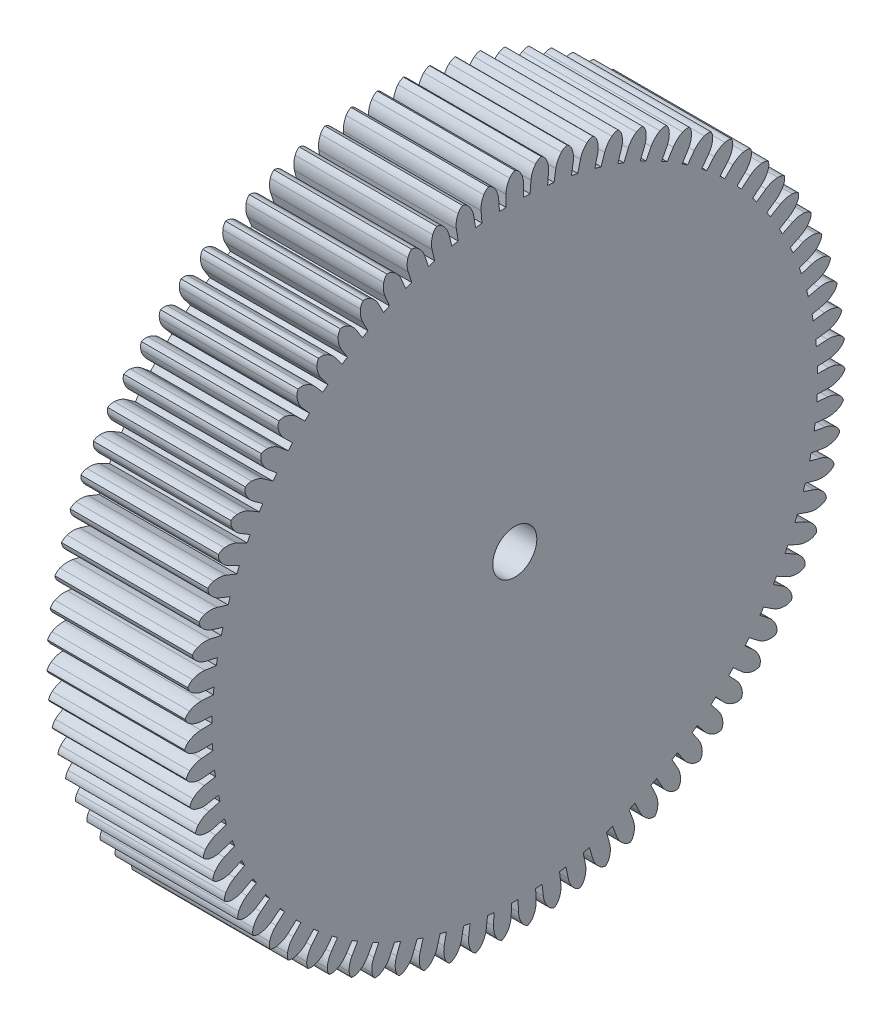
from build123d import *

# Parameters (mm, degrees)
SKETCH1_R           = 1.6
BOSS_EXTRUDE1_DEPTH = 10


with BuildPart() as part:
    # Sketch1 → Boss-Extrude1 (new body)
    with BuildSketch(Plane(origin=(0, 0, 0), x_dir=(0, 0, -1), z_dir=(1, 0, 0))):
        with BuildLine():
            Line((-0.64, 22.814432438), (-0.64, 21.990688939))
            ThreePointArc((-0.64, 21.990688939), (-0.874643332, 21.982606739), (-1.109187051, 21.972020938))
            Line((-1.109187051, 21.972020938), (-1.17463361, 22.793160452))
            ThreePointArc((-1.17463361, 22.793160452), (-1.278682757, 23.246762215), (-1.508864238, 23.651233809))
            ThreePointArc((-1.508864238, 23.651233809), (-1.686768732, 23.818400481), (-1.906804007, 23.924132136))
            ThreePointArc((-1.906804007, 23.924132136), (-2.107313727, 23.784882154), (-2.256493367, 23.591646184))
            ThreePointArc((-2.256493367, 23.591646184), (-2.419701384, 23.155820613), (-2.450587324, 22.691464238))
            Line((-2.450587324, 22.691464238), (-2.385140765, 21.870324724))
            ThreePointArc((-2.385140765, 21.870324724), (-2.61840022, 21.843625621), (-2.851361464, 21.814438746))
            Line((-2.851361464, 21.814438746), (-2.981840807, 22.627782766))
            ThreePointArc((-2.981840807, 22.627782766), (-3.121599774, 23.071683899), (-3.38318895, 23.456588936))
            ThreePointArc((-3.38318895, 23.456588936), (-3.57381248, 23.609092625), (-3.801552586, 23.697008206))
            ThreePointArc((-3.801552586, 23.697008206), (-3.990365027, 23.542267885), (-4.123720457, 23.337790418))
            ThreePointArc((-4.123720457, 23.337790418), (-4.251786133, 22.890375658), (-4.245681245, 22.425033294))
            Line((-4.245681245, 22.425033294), (-4.115201902, 21.611689275))
            ThreePointArc((-4.115201902, 21.611689275), (-4.345602738, 21.56654207), (-4.575508653, 21.518938649))
            Line((-4.575508653, 21.518938649), (-4.770195847, 22.319344952))
            ThreePointArc((-4.770195847, 22.319344952), (-4.944781033, 22.750738968), (-5.236124053, 23.113643955))
            ThreePointArc((-5.236124053, 23.113643955), (-5.438261435, 23.250520484), (-5.672266525, 23.320064161))
            ThreePointArc((-5.672266525, 23.320064161), (-5.848187956, 23.150811819), (-5.964876058, 22.936385626))
            ThreePointArc((-5.964876058, 22.936385626), (-6.056989721, 22.480210377), (-6.013932603, 22.01682407))
            Line((-6.013932603, 22.01682407), (-5.819245408, 21.216417767))
            ThreePointArc((-5.819245408, 21.216417767), (-6.045330957, 21.153107895), (-6.270728002, 21.087388893))
            Line((-6.270728002, 21.087388893), (-6.528392174, 21.869797052))
            ThreePointArc((-6.528392174, 21.869797052), (-6.736699794, 22.285956541), (-7.055954694, 22.624567075))
            ThreePointArc((-7.055954694, 22.624567075), (-7.268327949, 22.744951067), (-7.507118569, 22.795683161))
            ThreePointArc((-7.507118569, 22.795683161), (-7.669036756, 22.612988866), (-7.768319792, 22.38996962))
            ThreePointArc((-7.768319792, 22.38996962), (-7.823899069, 21.927917968), (-7.744161942, 21.469417395))
            Line((-7.744161942, 21.469417395), (-7.48649777, 20.687009236))
            ThreePointArc((-7.48649777, 20.687009236), (-7.706838646, 20.605936962), (-7.92630179, 20.522517875))
            Line((-7.92630179, 20.522517875), (-8.245313902, 21.281981255))
            ThreePointArc((-8.245313902, 21.281981255), (-8.48602697, 21.680275121), (-8.831175317, 21.992450398))
            ThreePointArc((-8.831175317, 21.992450398), (-9.052441755, 22.095580746), (-9.294508192, 22.127180513))
            ThreePointArc((-9.294508192, 22.127180513), (-9.441399438, 21.932199317), (-9.522649708, 21.701997017))
            ThreePointArc((-9.522649708, 21.701997017), (-9.541343208, 21.236990202), (-9.425430196, 20.786274151))
            Line((-9.425430196, 20.786274151), (-9.106418084, 20.026810772))
            ThreePointArc((-9.106418084, 20.026810772), (-9.319621221, 19.928488661), (-9.531762946, 19.827896892))
            Line((-9.531762946, 19.827896892), (-9.910106102, 20.55961392))
            ThreePointArc((-9.910106102, 20.55961392), (-10.181702751, 20.937524022), (-10.550562406, 21.221290368))
            ThreePointArc((-10.550562406, 21.221290368), (-10.779323109, 21.306515049), (-11.023134941, 21.318782706))
            ThreePointArc((-11.023134941, 21.318782706), (-11.154070552, 21.112747342), (-11.216774366, 20.876817402))
            ThreePointArc((-11.216774366, 20.876817402), (-11.198463904, 20.411795346), (-11.047107846, 19.97171339))
            Line((-11.047107846, 19.97171339), (-10.66876469, 19.239996362))
            ThreePointArc((-10.66876469, 19.239996362), (-10.87348215, 19.125046038), (-11.076961227, 19.00791756))
            Line((-11.076961227, 19.00791756), (-11.51224342, 19.707262086))
            ThreePointArc((-11.51224342, 19.707262086), (-11.813006529, 20.062399154), (-12.203245443, 20.315962508))
            ThreePointArc((-12.203245443, 20.315962508), (-12.438054111, 20.382742704), (-12.682069883, 20.37560069))
            ThreePointArc((-12.682069883, 20.37560069), (-12.796222041, 20.159813781), (-12.839982965, 19.919647825))
            ThreePointArc((-12.839982965, 19.919647825), (-12.784784305, 19.457550548), (-12.598942123, 19.030885026))
            Line((-12.598942123, 19.030885026), (-12.163659931, 18.3315405))
            ThreePointArc((-12.163659931, 18.3315405), (-12.358597423, 18.200688716), (-12.552127393, 18.067764054))
            Line((-12.552127393, 18.067764054), (-13.041596629, 18.730314596))
            ThreePointArc((-13.041596629, 18.730314596), (-13.369624676, 19.06043334), (-13.778775633, 19.282190592))
            ThreePointArc((-13.778775633, 19.282190592), (-14.018147731, 19.330104097), (-14.260824695, 19.303597566))
            ThreePointArc((-14.260824695, 19.303597566), (-14.357471694, 19.079423387), (-14.382013057, 18.836539821))
            ThreePointArc((-14.382013057, 18.836539821), (-14.290275184, 18.380288851), (-14.071121832, 17.969737279))
            Line((-14.071121832, 17.969737279), (-13.581652597, 17.307186737))
            ThreePointArc((-13.581652597, 17.307186737), (-13.765577665, 17.16126078), (-13.947934969, 17.013380326))
            Line((-13.947934969, 17.013380326), (-14.488496664, 17.634948027))
            ThreePointArc((-14.488496664, 17.634948027), (-14.841715751, 17.937961329), (-15.267191967, 18.126510459))
            ThreePointArc((-15.267191967, 18.126510459), (-15.509614107, 18.155254349), (-15.749417982, 18.109550884))
            ThreePointArc((-15.749417982, 18.109550884), (-15.827948789, 17.878406735), (-15.833115432, 17.634341147))
            ThreePointArc((-15.833115432, 17.634341147), (-15.705418342, 17.186821049), (-15.454339378, 16.794979068))
            Line((-15.454339378, 16.794979068), (-14.913777683, 16.173411367))
            ThreePointArc((-14.913777683, 16.173411367), (-15.085527492, 16.013333828), (-15.255559209, 15.851432529))
            Line((-15.255559209, 15.851432529), (-15.843795759, 16.428087638))
            ThreePointArc((-15.843795759, 16.428087638), (-16.219972721, 16.70207975), (-16.659084198, 16.85622869))
            ThreePointArc((-16.659084198, 16.85622869), (-16.90302371, 16.865621236), (-17.138438378, 16.80100979))
            ThreePointArc((-17.138438378, 16.80100979), (-17.198356495, 16.564357039), (-17.184115754, 16.320652491))
            ThreePointArc((-17.184115754, 16.320652491), (-17.021266788, 15.884692632), (-16.739849614, 15.514037591))
            Line((-16.739849614, 15.514037591), (-16.151613064, 14.937382482))
            ThreePointArc((-16.151613064, 14.937382482), (-16.310101757, 14.764165424), (-16.466732891, 14.589266873))
            Line((-16.466732891, 14.589266873), (-17.098925276, 15.11736359))
            ThreePointArc((-17.098925276, 15.11736359), (-17.495681801, 15.360602247), (-17.945652335, 15.479376417))
            ThreePointArc((-17.945652335, 15.479376417), (-18.189566954, 15.469358236), (-18.419104049, 15.386247302))
            ThreePointArc((-18.419104049, 15.386247302), (-18.460030654, 15.145582144), (-18.426472563, 14.903779415))
            ThreePointArc((-18.426472563, 14.903779415), (-18.229501305, 14.482136073), (-17.919525132, 14.135011374))
            Line((-17.919525132, 14.135011374), (-17.287332747, 13.606914657))
            ThreePointArc((-17.287332747, 13.606914657), (-17.431558308, 13.421653212), (-17.573798587, 13.234863174))
            Line((-17.573798587, 13.234863174), (-18.245949882, 13.711062701))
            ThreePointArc((-18.245949882, 13.711062701), (-18.660777548, 13.92201007), (-19.11876228, 14.004658542))
            ThreePointArc((-19.11876228, 14.004658542), (-19.361109899, 13.975292973), (-19.583318213, 13.874208005))
            ThreePointArc((-19.583318213, 13.874208005), (-19.604994555, 13.631052003), (-19.55233128, 13.392679847))
            ThreePointArc((-19.55233128, 13.392679847), (-19.322483046, 12.988018787), (-18.985907642, 12.666619063))
            Line((-18.985907642, 12.666619063), (-18.313756347, 12.190419536))
            ThreePointArc((-18.313756347, 12.190419536), (-18.442806935, 11.994284988), (-18.569757069, 11.796784409))
            Line((-18.569757069, 11.796784409), (-19.277617718, 12.21807606))
            ThreePointArc((-19.277617718, 12.21807606), (-19.707893851, 12.395398463), (-20.170997254, 12.441398706))
            ThreePointArc((-20.170997254, 12.441398706), (-20.410245674, 12.392871408), (-20.623720334, 12.274451498))
            ThreePointArc((-20.623720334, 12.274451498), (-20.626009369, 12.030341963), (-20.554573864, 11.796907445))
            ThreePointArc((-20.554573864, 11.796907445), (-20.293301828, 11.411787064), (-19.932255131, 11.118144309))
            Line((-19.932255131, 11.118144309), (-19.224394483, 10.696852658))
            ThreePointArc((-19.224394483, 10.696852658), (-19.337454198, 10.491085031), (-19.448311569, 10.284122574))
            Line((-19.448311569, 10.284122574), (-20.187406248, 10.647842808))
            ThreePointArc((-20.187406248, 10.647842808), (-20.630410503, 10.790419156), (-21.095704689, 10.799480342))
            ThreePointArc((-21.095704689, 10.799480342), (-21.330341305, 10.73209812), (-21.533732655, 10.597091957))
            ThreePointArc((-21.533732655, 10.597091957), (-21.51661991, 10.353572227), (-21.426863813, 10.126551196))
            ThreePointArc((-21.426863813, 10.126551196), (-21.135819822, 9.763406349), (-20.752584486, 9.499377067))
            Line((-20.752584486, 9.499377067), (-20.013489806, 9.135656833))
            ThreePointArc((-20.013489806, 9.135656833), (-20.10984385, 8.921557058), (-20.203907581, 8.706441206))
            Line((-20.203907581, 8.706441206), (-20.969563496, 9.010290466))
            ThreePointArc((-20.969563496, 9.010290466), (-21.422495058, 9.117219344), (-21.887038287, 9.089284186))
            ThreePointArc((-21.887038287, 9.089284186), (-22.11557965, 9.003473052), (-22.307601785, 8.852734189))
            ThreePointArc((-22.307601785, 8.852734189), (-22.271195453, 8.611343873), (-22.16368623, 8.39217163))
            ThreePointArc((-22.16368623, 8.39217163), (-21.844710357, 8.053298236), (-21.441709319, 7.820551704))
            Line((-21.441709319, 7.820551704), (-20.676053404, 7.516702444))
            ThreePointArc((-20.676053404, 7.516702444), (-20.755092594, 7.295624128), (-20.831767984, 7.073714913))
            Line((-20.831767984, 7.073714913), (-21.619144412, 7.315772166))
            ThreePointArc((-21.619144412, 7.315772166), (-22.079139701, 7.386377537), (-22.539994982, 7.321622649))
            ThreePointArc((-22.539994982, 7.321622649), (-22.760996179, 7.217925128), (-22.940435074, 7.052406584))
            ThreePointArc((-22.940435074, 7.052406584), (-22.884965328, 6.814671832), (-22.760382687, 6.604734053))
            ThreePointArc((-22.760382687, 6.604734053), (-22.415491601, 6.292274579), (-21.995272763, 6.092282296))
            Line((-21.995272763, 6.092282296), (-21.207896335, 5.850225042))
            ThreePointArc((-21.207896335, 5.850225042), (-21.26912096, 5.623565914), (-21.327923243, 5.396266317))
            Line((-21.327923243, 5.396266317), (-22.132042136, 5.575001199))
            ThreePointArc((-22.132042136, 5.575001199), (-22.596192915, 5.608836673), (-23.050446571, 5.507671456))
            ThreePointArc((-23.050446571, 5.507671456), (-23.262510363, 5.386743158), (-23.428231546, 5.207491395))
            ThreePointArc((-23.428231546, 5.207491395), (-23.354049083, 4.974915241), (-23.213180677, 4.775539221))
            ThreePointArc((-23.213180677, 4.775539221), (-22.844554889, 4.491469135), (-22.409775011, 4.325495517))
            Line((-22.409775011, 4.325495517), (-21.605656117, 4.146760634))
            ThreePointArc((-21.605656117, 4.146760634), (-21.648679096, 3.915953705), (-21.689236504, 3.684700787))
            Line((-21.689236504, 3.684700787), (-22.505013964, 3.79898328))
            ThreePointArc((-22.505013964, 3.79898328), (-22.970385722, 3.795834937), (-23.415165815, 3.658898991))
            ThreePointArc((-23.415165815, 3.658898991), (-23.616951466, 3.521504463), (-23.767907195, 3.329652768))
            ThreePointArc((-23.767907195, 3.329652768), (-23.675481021, 3.103705634), (-23.519217464, 2.916151892))
            ThreePointArc((-23.519217464, 2.916151892), (-23.129187546, 2.662267178), (-22.682595445, 2.531361563))
            Line((-22.682595445, 2.531361563), (-21.866817985, 2.41707907))
            ThreePointArc((-21.866817985, 2.41707907), (-21.891367311, 2.183583576), (-21.913423428, 1.949839393))
            Line((-21.913423428, 1.949839393), (-22.735701848, 1.998946965))
            ThreePointArc((-22.735701848, 1.998946965), (-23.199352354, 1.958834711), (-23.631846842, 1.786993789))
            ThreePointArc((-23.631846842, 1.786993789), (-23.822078598, 1.634001683), (-23.957314483, 1.430763004))
            ThreePointArc((-23.957314483, 1.430763004), (-23.847228945, 1.2128734), (-23.676558186, 1.038327711))
            ThreePointArc((-23.676558186, 1.038327711), (-23.267590033, 0.81623351), (-22.812009208, 0.721223526))
            Line((-22.812009208, 0.721223526), (-21.989730788, 0.672115954))
            ThreePointArc((-21.989730788, 0.672115954), (-21.995651255, 0.437408129), (-21.999066634, 0.202650487))
            Line((-21.999066634, 0.202650487), (-22.822647304, 0.186272664))
            ThreePointArc((-22.822647304, 0.186272664), (-23.281645211, 0.109450101), (-23.699119725, -0.096209364))
            ThreePointArc((-23.699119725, -0.096209364), (-23.876594879, -0.263831781), (-23.995255914, -0.477172504))
            ThreePointArc((-23.995255914, -0.477172504), (-23.868207009, -0.685627009), (-23.684208084, -0.846061111))
            ThreePointArc((-23.684208084, -0.846061111), (-23.258887324, -1.034960648), (-22.797198104, -1.093474318))
            Line((-22.797198104, -1.093474318), (-21.973617434, -1.077096495))
            ThreePointArc((-21.973617434, -1.077096495), (-21.960871609, -1.311532754), (-21.945624658, -1.545819641))
            Line((-21.945624658, -1.545819641), (-22.765300636, -1.627579313))
            ThreePointArc((-22.765300636, -1.627579313), (-23.216744012, -1.740626488), (-23.616559142, -1.97880425))
            ThreePointArc((-23.616559142, -1.97880425), (-23.78015564, -2.159997217), (-23.881491613, -2.382091174))
            ThreePointArc((-23.881491613, -2.382091174), (-23.738282584, -2.579792664), (-23.542118793, -2.725100862))
            ThreePointArc((-23.542118793, -2.725100862), (-23.10313444, -2.879611453), (-22.638255774, -2.901258866))
            Line((-22.638255774, -2.901258866), (-21.818579796, -2.819499194))
            ThreePointArc((-21.818579796, -2.819499194), (-21.787248262, -3.052181704), (-21.753435377, -3.2845166))
            Line((-21.753435377, -3.2845166), (-22.564024408, -3.43114121))
            ThreePointArc((-22.564024408, -3.43114121), (-23.005059081, -3.579698276), (-23.384687069, -3.848888498))
            ThreePointArc((-23.384687069, -3.848888498), (-23.5333706, -4.042506454), (-23.616740831, -4.271949496))
            ThreePointArc((-23.616740831, -4.271949496), (-23.458277093, -4.457648039), (-23.251188647, -4.586911649))
            ThreePointArc((-23.251188647, -4.586911649), (-22.801316102, -4.706056426), (-22.336187102, -4.690700721))
            Line((-22.336187102, -4.690700721), (-21.525598071, -4.544076111))
            ThreePointArc((-21.525598071, -4.544076111), (-21.475878917, -4.773533778), (-21.423713874, -5.002447787))
            Line((-21.423713874, -5.002447787), (-22.220091152, -5.213010327))
            ThreePointArc((-22.220091152, -5.213010327), (-22.64792876, -5.396138059), (-23.004969475, -5.694638834))
            ThreePointArc((-23.004969475, -5.694638834), (-23.137800014, -5.899457664), (-23.202677411, -6.134799179))
            ThreePointArc((-23.202677411, -6.134799179), (-23.029960822, -6.307320728), (-22.813257, -6.419722503))
            ThreePointArc((-22.813257, -6.419722503), (-22.355340502, -6.502748195), (-21.892901863, -6.450486455))
            Line((-21.892901863, -6.450486455), (-21.096524584, -6.239923916))
            ThreePointArc((-21.096524584, -6.239923916), (-21.028732151, -6.464706035), (-20.958544753, -6.688751889))
            Line((-20.958544753, -6.688751889), (-21.735675326, -6.961921114))
            ThreePointArc((-21.735675326, -6.961921114), (-22.147610942, -7.178461719), (-22.479807057, -7.50438583))
            ThreePointArc((-22.479807057, -7.50438583), (-22.595944807, -7.719110603), (-22.641919193, -7.958862685))
            ThreePointArc((-22.641919193, -7.958862685), (-22.456041723, -8.117116505), (-22.231092598, -8.211945805))
            ThreePointArc((-22.231092598, -8.211945805), (-21.768027242, -8.258327497), (-21.31120265, -8.169490138))
            Line((-21.31120265, -8.169490138), (-20.534072077, -7.896320913))
            ThreePointArc((-20.534072077, -7.896320913), (-20.448634969, -8.11500634), (-20.360868965, -8.332767548))
            Line((-20.360868965, -8.332767548), (-21.113839563, -8.666816394))
            ThreePointArc((-21.113839563, -8.666816394), (-21.507268796, -8.915400833), (-21.81252006, -9.266687682))
            ThreePointArc((-21.81252006, -9.266687682), (-21.911230762, -9.489960839), (-21.938011472, -9.7326077))
            ThreePointArc((-21.938011472, -9.7326077), (-21.740148299, -9.875593257), (-21.50837607, -9.952250541))
            ThreePointArc((-21.50837607, -9.952250541), (-21.043089505, -9.961694994), (-20.594767152, -9.836843673))
            Line((-20.594767152, -9.836843673), (-19.841796554, -9.502794826))
            ThreePointArc((-19.841796554, -9.502794826), (-19.739254934, -9.714000961), (-19.634465207, -9.924100767))
            Line((-19.634465207, -9.924100767), (-20.358515307, -10.316917271))
            ThreePointArc((-20.358515307, -10.316917271), (-20.730950772, -10.595973913), (-21.007327289, -10.970402552))
            ThreePointArc((-21.007327289, -10.970402552), (-21.087986861, -11.200812488), (-21.09540458, -11.444820034))
            ThreePointArc((-21.09540458, -11.444820034), (-20.886806657, -11.571633329), (-20.649676663, -11.629633945))
            ThreePointArc((-20.649676663, -11.629633945), (-20.185110581, -11.602081447), (-19.748124905, -11.442005516))
            Line((-19.748124905, -11.442005516), (-19.024074805, -11.049189011))
            ThreePointArc((-19.024074805, -11.049189011), (-18.905076973, -11.25158054), (-18.783926039, -11.452690626))
            Line((-18.783926039, -11.452690626), (-19.474477963, -11.901791275))
            ThreePointArc((-19.474477963, -11.901791275), (-19.823565003, -12.209555834), (-20.069319431, -12.604759004))
            ThreePointArc((-20.069319431, -12.604759004), (-20.131417917, -12.840848994), (-20.119425747, -13.084674532))
            ThreePointArc((-20.119425747, -13.084674532), (-19.901411898, -13.19451381), (-19.660423352, -13.233491058))
            ThreePointArc((-19.660423352, -13.233491058), (-19.199514889, -13.169115806), (-18.776628654, -12.974827315))
            Line((-18.776628654, -12.974827315), (-18.08607673, -12.525726666))
            ThreePointArc((-18.08607673, -12.525726666), (-17.951375028, -12.718024005), (-17.814628842, -12.908872887))
            Line((-17.814628842, -12.908872887), (-18.467316699, -13.411418323))
            ThreePointArc((-18.467316699, -13.411418323), (-18.790848273, -13.745945012), (-19.004426874, -14.159424111))
            ThreePointArc((-19.004426874, -14.159424111), (-19.047571667, -14.399701518), (-19.016245427, -14.641803504))
            ThreePointArc((-19.016245427, -14.641803504), (-18.790194006, -14.733974326), (-18.546870515, -14.753681781))
            ThreePointArc((-18.546870515, -14.753681781), (-18.092533682, -14.652890774), (-17.686420512, -14.425618079))
            Line((-17.686420512, -14.425618079), (-17.033732655, -13.923072643))
            ThreePointArc((-17.033732655, -13.923072643), (-16.884178711, -14.104060027), (-16.732701826, -14.283441098))
            Line((-16.732701826, -14.283441098), (-17.343399113, -14.836254066))
            ThreePointArc((-17.343399113, -14.836254066), (-17.63932975, -15.1954279), (-17.819382212, -15.624568781))
            ThreePointArc((-17.819382212, -15.624568781), (-17.843300537, -15.867514492), (-17.792838281, -16.106362281))
            ThreePointArc((-17.792838281, -16.106362281), (-17.560178458, -16.180281912), (-17.31605839, -16.180594977))
            ThreePointArc((-17.31605839, -16.180594977), (-16.871165652, -16.04402545), (-16.484393124, -15.785205441))
            Line((-16.484393124, -15.785205441), (-15.873695838, -15.232392473))
            ThreePointArc((-15.873695838, -15.232392473), (-15.71023518, -15.400925641), (-15.544985282, -15.567704795))
            Line((-15.544985282, -15.567704795), (-16.109830973, -16.167290234))
            ThreePointArc((-16.109830973, -16.167290234), (-16.376289705, -16.5488404), (-16.521677677, -16.990929895))
            ThreePointArc((-16.521677677, -16.990929895), (-16.526218316, -17.235007932), (-16.456939082, -17.469091449))
            ThreePointArc((-16.456939082, -17.469091449), (-16.219141807, -17.524292547), (-15.97576857, -17.505209242))
            ThreePointArc((-15.97576857, -17.505209242), (-15.54313268, -17.33372463), (-15.178146096, -17.044993651))
            Line((-15.178146096, -17.044993651), (-14.613300405, -16.445408213))
            ThreePointArc((-14.613300405, -16.445408213), (-14.436966484, -16.600421643), (-14.258988336, -16.75354445))
            Line((-14.258988336, -16.75354445), (-14.774411296, -17.396111587))
            ThreePointArc((-14.774411296, -17.396111587), (-15.009713484, -17.797625802), (-15.119517777, -18.249868881))
            ThreePointArc((-15.119517777, -18.249868881), (-15.104652021, -18.493536102), (-15.016993816, -18.721375396))
            ThreePointArc((-15.016993816, -18.721375396), (-14.77556252, -18.757508962), (-14.534474796, -18.719149938))
            ThreePointArc((-14.534474796, -18.719149938), (-14.116831019, -18.513834423), (-13.775937941, -18.197017924))
            Line((-13.775937941, -18.197017924), (-13.260514981, -17.554450787))
            ThreePointArc((-13.260514981, -17.554450787), (-13.072422637, -17.694964436), (-12.882841474, -17.833462803))
            Line((-12.882841474, -17.833462803), (-13.345583033, -18.514949122))
            ThreePointArc((-13.345583033, -18.514949122), (-13.548241022, -18.933888885), (-13.621767418, -19.393426319))
            ThreePointArc((-13.621767418, -19.393426319), (-13.587589253, -19.635142182), (-13.48210628, -19.855296781))
            ThreePointArc((-13.48210628, -19.855296781), (-13.238567369, -19.872134365), (-13.001289393, -19.81474214))
            ThreePointArc((-13.001289393, -19.81474214), (-12.601278208, -19.576893794), (-12.286633871, -19.233994791))
            Line((-12.286633871, -19.233994791), (-11.823892312, -18.552508472))
            ThreePointArc((-11.823892312, -18.552508472), (-11.625230726, -18.677633966), (-11.425245141, -18.800632263))
            Line((-11.425245141, -18.800632263), (-11.832379697, -19.516729188))
            ThreePointArc((-11.832379697, -19.516729188), (-12.001112217, -19.950445825), (-12.037895859, -20.414372272))
            ThreePointArc((-12.037895859, -20.414372272), (-11.984621371, -20.652608571), (-11.861980527, -20.863686587))
            ThreePointArc((-11.861980527, -20.863686587), (-11.617873733, -20.861121737), (-11.385905653, -20.785059164))
            ThreePointArc((-11.385905653, -20.785059164), (-11.006056058, -20.516181738), (-10.719649746, -20.149368149))
            Line((-10.719649746, -20.149368149), (-10.312515189, -19.433271224))
            ThreePointArc((-10.312515189, -19.433271224), (-10.104540363, -19.54221748), (-9.895414729, -19.648938072))
            Line((-9.895414729, -19.648938072), (-10.244368247, -20.395118208))
            ThreePointArc((-10.244368247, -20.395118208), (-10.378108518, -20.840869624), (-10.377916847, -21.306251991))
            ThreePointArc((-10.377916847, -21.306251991), (-10.305882855, -21.53950252), (-10.166859514, -21.740169448))
            ThreePointArc((-10.166859514, -21.740169448), (-9.923728159, -21.718218381), (-9.698536551, -21.623966351))
            ThreePointArc((-9.698536551, -21.623966351), (-9.341250078, -21.325759777), (-9.084892543, -20.937350715))
            Line((-9.084892543, -20.937350715), (-8.735939025, -20.191170579))
            ThreePointArc((-8.735939025, -20.191170579), (-8.519965842, -20.283248804), (-8.30302232, -20.373016968))
            Line((-8.30302232, -20.373016968), (-8.591588603, -21.144562723))
            ThreePointArc((-8.591588603, -21.144562723), (-8.689491074, -21.599530734), (-8.652325302, -22.063426725))
            ThreePointArc((-8.652325302, -22.063426725), (-8.561987228, -22.290216799), (-8.407460342, -22.479203958))
            ThreePointArc((-8.407460342, -22.479203958), (-8.16684158, -22.438005456), (-7.949850179, -22.326159861))
            ThreePointArc((-7.949850179, -22.326159861), (-7.617385708, -22.000509495), (-7.392697725, -21.592960608))
            Line((-7.392697725, -21.592960608), (-7.104131442, -20.821414852))
            ThreePointArc((-7.104131442, -20.821414852), (-6.881525354, -20.896042898), (-6.65813553, -20.968291091))
            Line((-6.65813553, -20.968291091), (-6.884490169, -21.760324506))
            ThreePointArc((-6.884490169, -21.760324506), (-6.945935871, -22.221632657), (-6.872030972, -22.681109371))
            ThreePointArc((-6.872030972, -22.681109371), (-6.763959962, -22.90000515), (-6.594906498, -23.076117704))
            ThreePointArc((-6.594906498, -23.076117704), (-6.358321599, -23.015932236), (-6.150902294, -22.887200199))
            ThreePointArc((-6.150902294, -22.887200199), (-5.845361773, -22.536164909), (-5.653763892, -22.112052852))
            Line((-5.653763892, -22.112052852), (-5.427409252, -21.320019437))
            ThreePointArc((-5.427409252, -21.320019437), (-5.199577648, -21.376725481), (-4.971153863, -21.430996927))
            Line((-4.971153863, -21.430996927), (-5.133865772, -22.23851051))
            ThreePointArc((-5.133865772, -22.23851051), (-5.158466224, -22.703242264), (-5.048289449, -23.155394741))
            ThreePointArc((-5.048289449, -23.155394741), (-4.923168762, -23.365012295), (-4.740657532, -23.527136803))
            ThreePointArc((-4.740657532, -23.527136803), (-4.509602261, -23.448344881), (-4.313066424, -23.303540289))
            ThreePointArc((-4.313066424, -23.303540289), (-4.036381578, -22.929339433), (-3.879085143, -22.491345579))
            Line((-3.879085143, -22.491345579), (-3.716373233, -21.683831995))
            ThreePointArc((-3.716373233, -21.683831995), (-3.484756537, -21.722257523), (-3.252742961, -21.7582091))
            Line((-3.252742961, -21.7582091), (-3.350783423, -22.576097491))
            ThreePointArc((-3.350783423, -22.576097491), (-3.338383094, -23.041314663), (-3.192631015, -23.48328425))
            ThreePointArc((-3.192631015, -23.48328425), (-3.051251705, -23.68229831), (-2.856436603, -23.829409769))
            ThreePointArc((-2.856436603, -23.829409769), (-2.632371767, -23.732509541), (-2.44796196, -23.572547894))
            ThreePointArc((-2.44796196, -23.572547894), (-2.20188208, -23.17754729), (-2.079881569, -22.728440777))
            Line((-2.079881569, -22.728440777), (-1.981841107, -21.910552385))
            ThreePointArc((-1.981841107, -21.910552385), (-1.747903673, -21.930454458), (-1.513767171, -21.947858869))
            Line((-1.513767171, -21.947858869), (-1.546516342, -22.770951115))
            ThreePointArc((-1.546516342, -22.770951115), (-1.49719363, -23.233712452), (-1.31678774, -23.662704876))
            ThreePointArc((-1.31678774, -23.662704876), (-1.160043652, -23.84985721), (-0.954156362, -23.981025533))
            ThreePointArc((-0.954156362, -23.981025533), (-0.73849857, -23.866629634), (-0.567380692, -23.692522262))
            ThreePointArc((-0.567380692, -23.692522262), (-0.353461574, -23.279219231), (-0.267528313, -22.821839455))
            Line((-0.267528313, -22.821839455), (-0.234779143, -21.998747209))
            ThreePointArc((-0.234779143, -21.998747209), (0, -22), (0.234779143, -21.998747209))
            Line((0.234779143, -21.998747209), (0.267528313, -22.821839455))
            ThreePointArc((0.267528313, -22.821839455), (0.353461574, -23.279219231), (0.567380692, -23.692522262))
            ThreePointArc((0.567380692, -23.692522262), (0.73849857, -23.866629634), (0.954156362, -23.981025533))
            ThreePointArc((0.954156362, -23.981025533), (1.160043652, -23.84985721), (1.31678774, -23.662704876))
            ThreePointArc((1.31678774, -23.662704876), (1.49719363, -23.233712452), (1.546516342, -22.770951115))
            Line((1.546516342, -22.770951115), (1.513767171, -21.947858869))
            ThreePointArc((1.513767171, -21.947858869), (1.747903673, -21.930454458), (1.981841107, -21.910552385))
            Line((1.981841107, -21.910552385), (2.079881569, -22.728440777))
            ThreePointArc((2.079881569, -22.728440777), (2.20188208, -23.17754729), (2.44796196, -23.572547894))
            ThreePointArc((2.44796196, -23.572547894), (2.632371767, -23.732509541), (2.856436603, -23.829409769))
            ThreePointArc((2.856436603, -23.829409769), (3.051251705, -23.68229831), (3.192631015, -23.48328425))
            ThreePointArc((3.192631015, -23.48328425), (3.338383094, -23.041314663), (3.350783423, -22.576097491))
            Line((3.350783423, -22.576097491), (3.252742961, -21.7582091))
            ThreePointArc((3.252742961, -21.7582091), (3.484756537, -21.722257523), (3.716373233, -21.683831995))
            Line((3.716373233, -21.683831995), (3.879085143, -22.491345579))
            ThreePointArc((3.879085143, -22.491345579), (4.036381578, -22.929339433), (4.313066424, -23.303540289))
            ThreePointArc((4.313066424, -23.303540289), (4.509602261, -23.448344881), (4.740657532, -23.527136803))
            ThreePointArc((4.740657532, -23.527136803), (4.923168762, -23.365012295), (5.048289449, -23.155394741))
            ThreePointArc((5.048289449, -23.155394741), (5.158466224, -22.703242264), (5.133865772, -22.23851051))
            Line((5.133865772, -22.23851051), (4.971153863, -21.430996927))
            ThreePointArc((4.971153863, -21.430996927), (5.199577648, -21.376725481), (5.427409252, -21.320019437))
            Line((5.427409252, -21.320019437), (5.653763892, -22.112052852))
            ThreePointArc((5.653763892, -22.112052852), (5.845361773, -22.536164909), (6.150902294, -22.887200199))
            ThreePointArc((6.150902294, -22.887200199), (6.358321599, -23.015932236), (6.594906498, -23.076117704))
            ThreePointArc((6.594906498, -23.076117704), (6.763959962, -22.90000515), (6.872030972, -22.681109371))
            ThreePointArc((6.872030972, -22.681109371), (6.945935871, -22.221632657), (6.884490169, -21.760324506))
            Line((6.884490169, -21.760324506), (6.65813553, -20.968291091))
            ThreePointArc((6.65813553, -20.968291091), (6.881525354, -20.896042898), (7.104131442, -20.821414852))
            Line((7.104131442, -20.821414852), (7.392697725, -21.592960608))
            ThreePointArc((7.392697725, -21.592960608), (7.617385708, -22.000509495), (7.949850179, -22.326159861))
            ThreePointArc((7.949850179, -22.326159861), (8.16684158, -22.438005456), (8.407460342, -22.479203958))
            ThreePointArc((8.407460342, -22.479203958), (8.561987228, -22.290216799), (8.652325302, -22.063426725))
            ThreePointArc((8.652325302, -22.063426725), (8.689491074, -21.599530734), (8.591588603, -21.144562723))
            Line((8.591588603, -21.144562723), (8.30302232, -20.373016968))
            ThreePointArc((8.30302232, -20.373016968), (8.519965842, -20.283248804), (8.735939025, -20.191170579))
            Line((8.735939025, -20.191170579), (9.084892543, -20.937350715))
            ThreePointArc((9.084892543, -20.937350715), (9.341250078, -21.325759777), (9.698536551, -21.623966351))
            ThreePointArc((9.698536551, -21.623966351), (9.923728159, -21.718218381), (10.166859514, -21.740169448))
            ThreePointArc((10.166859514, -21.740169448), (10.305882855, -21.53950252), (10.377916847, -21.306251991))
            ThreePointArc((10.377916847, -21.306251991), (10.378108518, -20.840869624), (10.244368247, -20.395118208))
            Line((10.244368247, -20.395118208), (9.895414729, -19.648938072))
            ThreePointArc((9.895414729, -19.648938072), (10.104540363, -19.54221748), (10.312515189, -19.433271224))
            Line((10.312515189, -19.433271224), (10.719649746, -20.149368149))
            ThreePointArc((10.719649746, -20.149368149), (11.006056058, -20.516181738), (11.385905653, -20.785059164))
            ThreePointArc((11.385905653, -20.785059164), (11.617873733, -20.861121737), (11.861980527, -20.863686587))
            ThreePointArc((11.861980527, -20.863686587), (11.984621371, -20.652608571), (12.037895859, -20.414372272))
            ThreePointArc((12.037895859, -20.414372272), (12.001112217, -19.950445825), (11.832379697, -19.516729188))
            Line((11.832379697, -19.516729188), (11.425245141, -18.800632263))
            ThreePointArc((11.425245141, -18.800632263), (11.625230726, -18.677633966), (11.823892312, -18.552508472))
            Line((11.823892312, -18.552508472), (12.286633871, -19.233994791))
            ThreePointArc((12.286633871, -19.233994791), (12.601278208, -19.576893794), (13.001289393, -19.81474214))
            ThreePointArc((13.001289393, -19.81474214), (13.238567369, -19.872134365), (13.48210628, -19.855296781))
            ThreePointArc((13.48210628, -19.855296781), (13.587589253, -19.635142182), (13.621767418, -19.393426319))
            ThreePointArc((13.621767418, -19.393426319), (13.548241022, -18.933888885), (13.345583033, -18.514949122))
            Line((13.345583033, -18.514949122), (12.882841474, -17.833462803))
            ThreePointArc((12.882841474, -17.833462803), (13.072422637, -17.694964436), (13.260514981, -17.554450787))
            Line((13.260514981, -17.554450787), (13.775937941, -18.197017924))
            ThreePointArc((13.775937941, -18.197017924), (14.116831019, -18.513834423), (14.534474796, -18.719149938))
            ThreePointArc((14.534474796, -18.719149938), (14.77556252, -18.757508962), (15.016993816, -18.721375396))
            ThreePointArc((15.016993816, -18.721375396), (15.104652021, -18.493536102), (15.119517777, -18.249868881))
            ThreePointArc((15.119517777, -18.249868881), (15.009713484, -17.797625802), (14.774411296, -17.396111587))
            Line((14.774411296, -17.396111587), (14.258988336, -16.75354445))
            ThreePointArc((14.258988336, -16.75354445), (14.436966484, -16.600421643), (14.613300405, -16.445408213))
            Line((14.613300405, -16.445408213), (15.178146096, -17.044993651))
            ThreePointArc((15.178146096, -17.044993651), (15.54313268, -17.33372463), (15.97576857, -17.505209242))
            ThreePointArc((15.97576857, -17.505209242), (16.219141807, -17.524292547), (16.456939082, -17.469091449))
            ThreePointArc((16.456939082, -17.469091449), (16.526218316, -17.235007932), (16.521677677, -16.990929895))
            ThreePointArc((16.521677677, -16.990929895), (16.376289705, -16.5488404), (16.109830973, -16.167290234))
            Line((16.109830973, -16.167290234), (15.544985282, -15.567704795))
            ThreePointArc((15.544985282, -15.567704795), (15.71023518, -15.400925641), (15.873695838, -15.232392473))
            Line((15.873695838, -15.232392473), (16.484393124, -15.785205441))
            ThreePointArc((16.484393124, -15.785205441), (16.871165652, -16.04402545), (17.31605839, -16.180594977))
            ThreePointArc((17.31605839, -16.180594977), (17.560178458, -16.180281912), (17.792838281, -16.106362281))
            ThreePointArc((17.792838281, -16.106362281), (17.843300537, -15.867514492), (17.819382212, -15.624568781))
            ThreePointArc((17.819382212, -15.624568781), (17.63932975, -15.1954279), (17.343399113, -14.836254066))
            Line((17.343399113, -14.836254066), (16.732701826, -14.283441098))
            ThreePointArc((16.732701826, -14.283441098), (16.884178711, -14.104060027), (17.033732655, -13.923072643))
            Line((17.033732655, -13.923072643), (17.686420512, -14.425618079))
            ThreePointArc((17.686420512, -14.425618079), (18.092533682, -14.652890774), (18.546870515, -14.753681781))
            ThreePointArc((18.546870515, -14.753681781), (18.790194006, -14.733974326), (19.016245427, -14.641803504))
            ThreePointArc((19.016245427, -14.641803504), (19.047571667, -14.399701518), (19.004426874, -14.159424111))
            ThreePointArc((19.004426874, -14.159424111), (18.790848273, -13.745945012), (18.467316699, -13.411418323))
            Line((18.467316699, -13.411418323), (17.814628842, -12.908872887))
            ThreePointArc((17.814628842, -12.908872887), (17.951375028, -12.718024005), (18.08607673, -12.525726666))
            Line((18.08607673, -12.525726666), (18.776628654, -12.974827315))
            ThreePointArc((18.776628654, -12.974827315), (19.199514889, -13.169115806), (19.660423352, -13.233491058))
            ThreePointArc((19.660423352, -13.233491058), (19.901411898, -13.19451381), (20.119425747, -13.084674532))
            ThreePointArc((20.119425747, -13.084674532), (20.131417917, -12.840848994), (20.069319431, -12.604759004))
            ThreePointArc((20.069319431, -12.604759004), (19.823565003, -12.209555834), (19.474477963, -11.901791275))
            Line((19.474477963, -11.901791275), (18.783926039, -11.452690626))
            ThreePointArc((18.783926039, -11.452690626), (18.905076973, -11.25158054), (19.024074805, -11.049189011))
            Line((19.024074805, -11.049189011), (19.748124905, -11.442005516))
            ThreePointArc((19.748124905, -11.442005516), (20.185110581, -11.602081447), (20.649676663, -11.629633945))
            ThreePointArc((20.649676663, -11.629633945), (20.886806657, -11.571633329), (21.09540458, -11.444820034))
            ThreePointArc((21.09540458, -11.444820034), (21.087986861, -11.200812488), (21.007327289, -10.970402552))
            ThreePointArc((21.007327289, -10.970402552), (20.730950772, -10.595973913), (20.358515307, -10.316917271))
            Line((20.358515307, -10.316917271), (19.634465207, -9.924100767))
            ThreePointArc((19.634465207, -9.924100767), (19.739254934, -9.714000961), (19.841796554, -9.502794826))
            Line((19.841796554, -9.502794826), (20.594767152, -9.836843673))
            ThreePointArc((20.594767152, -9.836843673), (21.043089505, -9.961694994), (21.50837607, -9.952250541))
            ThreePointArc((21.50837607, -9.952250541), (21.740148299, -9.875593257), (21.938011472, -9.7326077))
            ThreePointArc((21.938011472, -9.7326077), (21.911230762, -9.489960839), (21.81252006, -9.266687682))
            ThreePointArc((21.81252006, -9.266687682), (21.507268796, -8.915400833), (21.113839563, -8.666816394))
            Line((21.113839563, -8.666816394), (20.360868965, -8.332767548))
            ThreePointArc((20.360868965, -8.332767548), (20.448634969, -8.11500634), (20.534072077, -7.896320913))
            Line((20.534072077, -7.896320913), (21.31120265, -8.169490138))
            ThreePointArc((21.31120265, -8.169490138), (21.768027242, -8.258327497), (22.231092598, -8.211945805))
            ThreePointArc((22.231092598, -8.211945805), (22.456041723, -8.117116505), (22.641919193, -7.958862685))
            ThreePointArc((22.641919193, -7.958862685), (22.595944807, -7.719110603), (22.479807057, -7.50438583))
            ThreePointArc((22.479807057, -7.50438583), (22.147610942, -7.178461719), (21.735675326, -6.961921114))
            Line((21.735675326, -6.961921114), (20.958544753, -6.688751889))
            ThreePointArc((20.958544753, -6.688751889), (21.028732151, -6.464706035), (21.096524584, -6.239923916))
            Line((21.096524584, -6.239923916), (21.892901863, -6.450486455))
            ThreePointArc((21.892901863, -6.450486455), (22.355340502, -6.502748195), (22.813257, -6.419722503))
            ThreePointArc((22.813257, -6.419722503), (23.029960822, -6.307320728), (23.202677411, -6.134799179))
            ThreePointArc((23.202677411, -6.134799179), (23.137800014, -5.899457664), (23.004969475, -5.694638834))
            ThreePointArc((23.004969475, -5.694638834), (22.64792876, -5.396138059), (22.220091152, -5.213010327))
            Line((22.220091152, -5.213010327), (21.423713874, -5.002447787))
            ThreePointArc((21.423713874, -5.002447787), (21.475878917, -4.773533778), (21.525598071, -4.544076111))
            Line((21.525598071, -4.544076111), (22.336187102, -4.690700721))
            ThreePointArc((22.336187102, -4.690700721), (22.801316102, -4.706056426), (23.251188647, -4.586911649))
            ThreePointArc((23.251188647, -4.586911649), (23.458277093, -4.457648039), (23.616740831, -4.271949496))
            ThreePointArc((23.616740831, -4.271949496), (23.5333706, -4.042506454), (23.384687069, -3.848888498))
            ThreePointArc((23.384687069, -3.848888498), (23.005059081, -3.579698276), (22.564024408, -3.43114121))
            Line((22.564024408, -3.43114121), (21.753435377, -3.2845166))
            ThreePointArc((21.753435377, -3.2845166), (21.787248262, -3.052181704), (21.818579796, -2.819499194))
            Line((21.818579796, -2.819499194), (22.638255774, -2.901258866))
            ThreePointArc((22.638255774, -2.901258866), (23.10313444, -2.879611453), (23.542118793, -2.725100862))
            ThreePointArc((23.542118793, -2.725100862), (23.738282584, -2.579792664), (23.881491613, -2.382091174))
            ThreePointArc((23.881491613, -2.382091174), (23.78015564, -2.159997217), (23.616559142, -1.97880425))
            ThreePointArc((23.616559142, -1.97880425), (23.216744012, -1.740626488), (22.765300636, -1.627579313))
            Line((22.765300636, -1.627579313), (21.945624658, -1.545819641))
            ThreePointArc((21.945624658, -1.545819641), (21.960871609, -1.311532754), (21.973617434, -1.077096495))
            Line((21.973617434, -1.077096495), (22.797198104, -1.093474318))
            ThreePointArc((22.797198104, -1.093474318), (23.258887324, -1.034960648), (23.684208084, -0.846061111))
            ThreePointArc((23.684208084, -0.846061111), (23.868207009, -0.685627009), (23.995255914, -0.477172504))
            ThreePointArc((23.995255914, -0.477172504), (23.876594879, -0.263831781), (23.699119725, -0.096209364))
            ThreePointArc((23.699119725, -0.096209364), (23.281645211, 0.109450101), (22.822647304, 0.186272664))
            Line((22.822647304, 0.186272664), (21.999066634, 0.202650487))
            ThreePointArc((21.999066634, 0.202650487), (21.995651255, 0.437408129), (21.989730788, 0.672115954))
            Line((21.989730788, 0.672115954), (22.812009208, 0.721223526))
            ThreePointArc((22.812009208, 0.721223526), (23.267590033, 0.81623351), (23.676558186, 1.038327711))
            ThreePointArc((23.676558186, 1.038327711), (23.847228945, 1.2128734), (23.957314483, 1.430763004))
            ThreePointArc((23.957314483, 1.430763004), (23.822078598, 1.634001683), (23.631846842, 1.786993789))
            ThreePointArc((23.631846842, 1.786993789), (23.199352354, 1.958834711), (22.735701848, 1.998946965))
            Line((22.735701848, 1.998946965), (21.913423428, 1.949839393))
            ThreePointArc((21.913423428, 1.949839393), (21.891367311, 2.183583576), (21.866817985, 2.41707907))
            Line((21.866817985, 2.41707907), (22.682595445, 2.531361563))
            ThreePointArc((22.682595445, 2.531361563), (23.129187546, 2.662267178), (23.519217464, 2.916151892))
            ThreePointArc((23.519217464, 2.916151892), (23.675481021, 3.103705634), (23.767907195, 3.329652768))
            ThreePointArc((23.767907195, 3.329652768), (23.616951466, 3.521504463), (23.415165815, 3.658898991))
            ThreePointArc((23.415165815, 3.658898991), (22.970385722, 3.795834937), (22.505013964, 3.79898328))
            Line((22.505013964, 3.79898328), (21.689236504, 3.684700787))
            ThreePointArc((21.689236504, 3.684700787), (21.648679096, 3.915953705), (21.605656117, 4.146760634))
            Line((21.605656117, 4.146760634), (22.409775011, 4.325495517))
            ThreePointArc((22.409775011, 4.325495517), (22.844554889, 4.491469135), (23.213180677, 4.775539221))
            ThreePointArc((23.213180677, 4.775539221), (23.354049083, 4.974915241), (23.428231546, 5.207491395))
            ThreePointArc((23.428231546, 5.207491395), (23.262510363, 5.386743158), (23.050446571, 5.507671456))
            ThreePointArc((23.050446571, 5.507671456), (22.596192915, 5.608836673), (22.132042136, 5.575001199))
            Line((22.132042136, 5.575001199), (21.327923243, 5.396266317))
            ThreePointArc((21.327923243, 5.396266317), (21.26912096, 5.623565914), (21.207896335, 5.850225042))
            Line((21.207896335, 5.850225042), (21.995272763, 6.092282296))
            ThreePointArc((21.995272763, 6.092282296), (22.415491601, 6.292274579), (22.760382687, 6.604734053))
            ThreePointArc((22.760382687, 6.604734053), (22.884965328, 6.814671832), (22.940435074, 7.052406584))
            ThreePointArc((22.940435074, 7.052406584), (22.760996179, 7.217925128), (22.539994982, 7.321622649))
            ThreePointArc((22.539994982, 7.321622649), (22.079139701, 7.386377537), (21.619144412, 7.315772166))
            Line((21.619144412, 7.315772166), (20.831767984, 7.073714913))
            ThreePointArc((20.831767984, 7.073714913), (20.755092594, 7.295624128), (20.676053404, 7.516702444))
            Line((20.676053404, 7.516702444), (21.441709319, 7.820551704))
            ThreePointArc((21.441709319, 7.820551704), (21.844710357, 8.053298236), (22.16368623, 8.39217163))
            ThreePointArc((22.16368623, 8.39217163), (22.271195453, 8.611343873), (22.307601785, 8.852734189))
            ThreePointArc((22.307601785, 8.852734189), (22.11557965, 9.003473052), (21.887038287, 9.089284186))
            ThreePointArc((21.887038287, 9.089284186), (21.422495058, 9.117219344), (20.969563496, 9.010290466))
            Line((20.969563496, 9.010290466), (20.203907581, 8.706441206))
            ThreePointArc((20.203907581, 8.706441206), (20.10984385, 8.921557058), (20.013489806, 9.135656833))
            Line((20.013489806, 9.135656833), (20.752584486, 9.499377067))
            ThreePointArc((20.752584486, 9.499377067), (21.135819822, 9.763406349), (21.426863813, 10.126551196))
            ThreePointArc((21.426863813, 10.126551196), (21.51661991, 10.353572227), (21.533732655, 10.597091957))
            ThreePointArc((21.533732655, 10.597091957), (21.330341305, 10.73209812), (21.095704689, 10.799480342))
            ThreePointArc((21.095704689, 10.799480342), (20.630410503, 10.790419156), (20.187406248, 10.647842808))
            Line((20.187406248, 10.647842808), (19.448311569, 10.284122574))
            ThreePointArc((19.448311569, 10.284122574), (19.337454198, 10.491085031), (19.224394483, 10.696852658))
            Line((19.224394483, 10.696852658), (19.932255131, 11.118144309))
            ThreePointArc((19.932255131, 11.118144309), (20.293301828, 11.411787064), (20.554573864, 11.796907445))
            ThreePointArc((20.554573864, 11.796907445), (20.626009369, 12.030341963), (20.623720334, 12.274451498))
            ThreePointArc((20.623720334, 12.274451498), (20.410245674, 12.392871408), (20.170997254, 12.441398706))
            ThreePointArc((20.170997254, 12.441398706), (19.707893851, 12.395398463), (19.277617718, 12.21807606))
            Line((19.277617718, 12.21807606), (18.569757069, 11.796784409))
            ThreePointArc((18.569757069, 11.796784409), (18.442806935, 11.994284988), (18.313756347, 12.190419536))
            Line((18.313756347, 12.190419536), (18.985907642, 12.666619063))
            ThreePointArc((18.985907642, 12.666619063), (19.322483046, 12.988018787), (19.55233128, 13.392679847))
            ThreePointArc((19.55233128, 13.392679847), (19.604994555, 13.631052003), (19.583318213, 13.874208005))
            ThreePointArc((19.583318213, 13.874208005), (19.361109899, 13.975292973), (19.11876228, 14.004658542))
            ThreePointArc((19.11876228, 14.004658542), (18.660777548, 13.92201007), (18.245949882, 13.711062701))
            Line((18.245949882, 13.711062701), (17.573798587, 13.234863174))
            ThreePointArc((17.573798587, 13.234863174), (17.431558308, 13.421653212), (17.287332747, 13.606914657))
            Line((17.287332747, 13.606914657), (17.919525132, 14.135011374))
            ThreePointArc((17.919525132, 14.135011374), (18.229501305, 14.482136073), (18.426472563, 14.903779415))
            ThreePointArc((18.426472563, 14.903779415), (18.460030654, 15.145582144), (18.419104049, 15.386247302))
            ThreePointArc((18.419104049, 15.386247302), (18.189566954, 15.469358236), (17.945652335, 15.479376417))
            ThreePointArc((17.945652335, 15.479376417), (17.495681801, 15.360602247), (17.098925276, 15.11736359))
            Line((17.098925276, 15.11736359), (16.466732891, 14.589266873))
            ThreePointArc((16.466732891, 14.589266873), (16.310101757, 14.764165424), (16.151613064, 14.937382482))
            Line((16.151613064, 14.937382482), (16.739849614, 15.514037591))
            ThreePointArc((16.739849614, 15.514037591), (17.021266788, 15.884692632), (17.184115754, 16.320652491))
            ThreePointArc((17.184115754, 16.320652491), (17.198356495, 16.564357039), (17.138438378, 16.80100979))
            ThreePointArc((17.138438378, 16.80100979), (16.90302371, 16.865621236), (16.659084198, 16.85622869))
            ThreePointArc((16.659084198, 16.85622869), (16.219972721, 16.70207975), (15.843795759, 16.428087638))
            Line((15.843795759, 16.428087638), (15.255559209, 15.851432529))
            ThreePointArc((15.255559209, 15.851432529), (15.085527492, 16.013333828), (14.913777683, 16.173411367))
            Line((14.913777683, 16.173411367), (15.454339378, 16.794979068))
            ThreePointArc((15.454339378, 16.794979068), (15.705418342, 17.186821049), (15.833115432, 17.634341147))
            ThreePointArc((15.833115432, 17.634341147), (15.827948789, 17.878406735), (15.749417982, 18.109550884))
            ThreePointArc((15.749417982, 18.109550884), (15.509614107, 18.155254349), (15.267191967, 18.126510459))
            ThreePointArc((15.267191967, 18.126510459), (14.841715751, 17.937961329), (14.488496664, 17.634948027))
            Line((14.488496664, 17.634948027), (13.947934969, 17.013380326))
            ThreePointArc((13.947934969, 17.013380326), (13.765577665, 17.16126078), (13.581652597, 17.307186737))
            Line((13.581652597, 17.307186737), (14.071121832, 17.969737279))
            ThreePointArc((14.071121832, 17.969737279), (14.290275184, 18.380288851), (14.382013057, 18.836539821))
            ThreePointArc((14.382013057, 18.836539821), (14.357471694, 19.079423387), (14.260824695, 19.303597566))
            ThreePointArc((14.260824695, 19.303597566), (14.018147731, 19.330104097), (13.778775633, 19.282190592))
            ThreePointArc((13.778775633, 19.282190592), (13.369624676, 19.06043334), (13.041596629, 18.730314596))
            Line((13.041596629, 18.730314596), (12.552127393, 18.067764054))
            ThreePointArc((12.552127393, 18.067764054), (12.358597423, 18.200688716), (12.163659931, 18.3315405))
            Line((12.163659931, 18.3315405), (12.598942123, 19.030885026))
            ThreePointArc((12.598942123, 19.030885026), (12.784784305, 19.457550548), (12.839982965, 19.919647825))
            ThreePointArc((12.839982965, 19.919647825), (12.796222041, 20.159813781), (12.682069883, 20.37560069))
            ThreePointArc((12.682069883, 20.37560069), (12.438054111, 20.382742704), (12.203245443, 20.315962508))
            ThreePointArc((12.203245443, 20.315962508), (11.813006529, 20.062399154), (11.51224342, 19.707262086))
            Line((11.51224342, 19.707262086), (11.076961227, 19.00791756))
            ThreePointArc((11.076961227, 19.00791756), (10.87348215, 19.125046038), (10.66876469, 19.239996362))
            Line((10.66876469, 19.239996362), (11.047107846, 19.97171339))
            ThreePointArc((11.047107846, 19.97171339), (11.198463904, 20.411795346), (11.216774366, 20.876817402))
            ThreePointArc((11.216774366, 20.876817402), (11.154070552, 21.112747342), (11.023134941, 21.318782706))
            ThreePointArc((11.023134941, 21.318782706), (10.779323109, 21.306515049), (10.550562406, 21.221290368))
            ThreePointArc((10.550562406, 21.221290368), (10.181702751, 20.937524022), (9.910106102, 20.55961392))
            Line((9.910106102, 20.55961392), (9.531762946, 19.827896892))
            ThreePointArc((9.531762946, 19.827896892), (9.319621221, 19.928488661), (9.106418084, 20.026810772))
            Line((9.106418084, 20.026810772), (9.425430196, 20.786274151))
            ThreePointArc((9.425430196, 20.786274151), (9.541343208, 21.236990202), (9.522649708, 21.701997017))
            ThreePointArc((9.522649708, 21.701997017), (9.441399438, 21.932199317), (9.294508192, 22.127180513))
            ThreePointArc((9.294508192, 22.127180513), (9.052441755, 22.095580746), (8.831175317, 21.992450398))
            ThreePointArc((8.831175317, 21.992450398), (8.48602697, 21.680275121), (8.245313902, 21.281981255))
            Line((8.245313902, 21.281981255), (7.92630179, 20.522517875))
            ThreePointArc((7.92630179, 20.522517875), (7.706838646, 20.605936962), (7.48649777, 20.687009236))
            Line((7.48649777, 20.687009236), (7.744161942, 21.469417395))
            ThreePointArc((7.744161942, 21.469417395), (7.823899069, 21.927917968), (7.768319792, 22.38996962))
            ThreePointArc((7.768319792, 22.38996962), (7.669036756, 22.612988866), (7.507118569, 22.795683161))
            ThreePointArc((7.507118569, 22.795683161), (7.268327949, 22.744951067), (7.055954694, 22.624567075))
            ThreePointArc((7.055954694, 22.624567075), (6.736699794, 22.285956541), (6.528392174, 21.869797052))
            Line((6.528392174, 21.869797052), (6.270728002, 21.087388893))
            ThreePointArc((6.270728002, 21.087388893), (6.045330957, 21.153107895), (5.819245408, 21.216417767))
            Line((5.819245408, 21.216417767), (6.013932603, 22.01682407))
            ThreePointArc((6.013932603, 22.01682407), (6.056989721, 22.480210377), (5.964876058, 22.936385626))
            ThreePointArc((5.964876058, 22.936385626), (5.848187956, 23.150811819), (5.672266525, 23.320064161))
            ThreePointArc((5.672266525, 23.320064161), (5.438261435, 23.250520484), (5.236124053, 23.113643955))
            ThreePointArc((5.236124053, 23.113643955), (4.944781033, 22.750738968), (4.770195847, 22.319344952))
            Line((4.770195847, 22.319344952), (4.575508653, 21.518938649))
            ThreePointArc((4.575508653, 21.518938649), (4.345602738, 21.56654207), (4.115201902, 21.611689275))
            Line((4.115201902, 21.611689275), (4.245681245, 22.425033294))
            ThreePointArc((4.245681245, 22.425033294), (4.251786133, 22.890375658), (4.123720457, 23.337790418))
            ThreePointArc((4.123720457, 23.337790418), (3.990365027, 23.542267885), (3.801552586, 23.697008206))
            ThreePointArc((3.801552586, 23.697008206), (3.57381248, 23.609092625), (3.38318895, 23.456588936))
            ThreePointArc((3.38318895, 23.456588936), (3.121599774, 23.071683899), (2.981840807, 22.627782766))
            Line((2.981840807, 22.627782766), (2.851361464, 21.814438746))
            ThreePointArc((2.851361464, 21.814438746), (2.61840022, 21.843625621), (2.385140765, 21.870324724))
            Line((2.385140765, 21.870324724), (2.450587324, 22.691464238))
            ThreePointArc((2.450587324, 22.691464238), (2.419701384, 23.155820613), (2.256493367, 23.591646184))
            ThreePointArc((2.256493367, 23.591646184), (2.107313727, 23.784882154), (1.906804007, 23.924132136))
            ThreePointArc((1.906804007, 23.924132136), (1.686768732, 23.818400481), (1.508864238, 23.651233809))
            ThreePointArc((1.508864238, 23.651233809), (1.278682757, 23.246762215), (1.17463361, 22.793160452))
            Line((1.17463361, 22.793160452), (1.109187051, 21.972020938))
            ThreePointArc((1.109187051, 21.972020938), (0.874643332, 21.982606739), (0.64, 21.990688939))
            Line((0.64, 21.990688939), (0.64, 22.814432438))
            ThreePointArc((0.64, 22.814432438), (0.572318505, 23.274867016), (0.375, 23.696347967))
            ThreePointArc((0.375, 23.696347967), (0.21093931, 23.87712074), (0, 24))
            ThreePointArc((0, 24), (-0.21093931, 23.87712074), (-0.375, 23.696347967))
            ThreePointArc((-0.375, 23.696347967), (-0.572318505, 23.274867016), (-0.64, 22.814432438))
        make_face()
        Circle(SKETCH1_R, mode=Mode.SUBTRACT)
    extrude(amount=BOSS_EXTRUDE1_DEPTH)


solid = part.part
